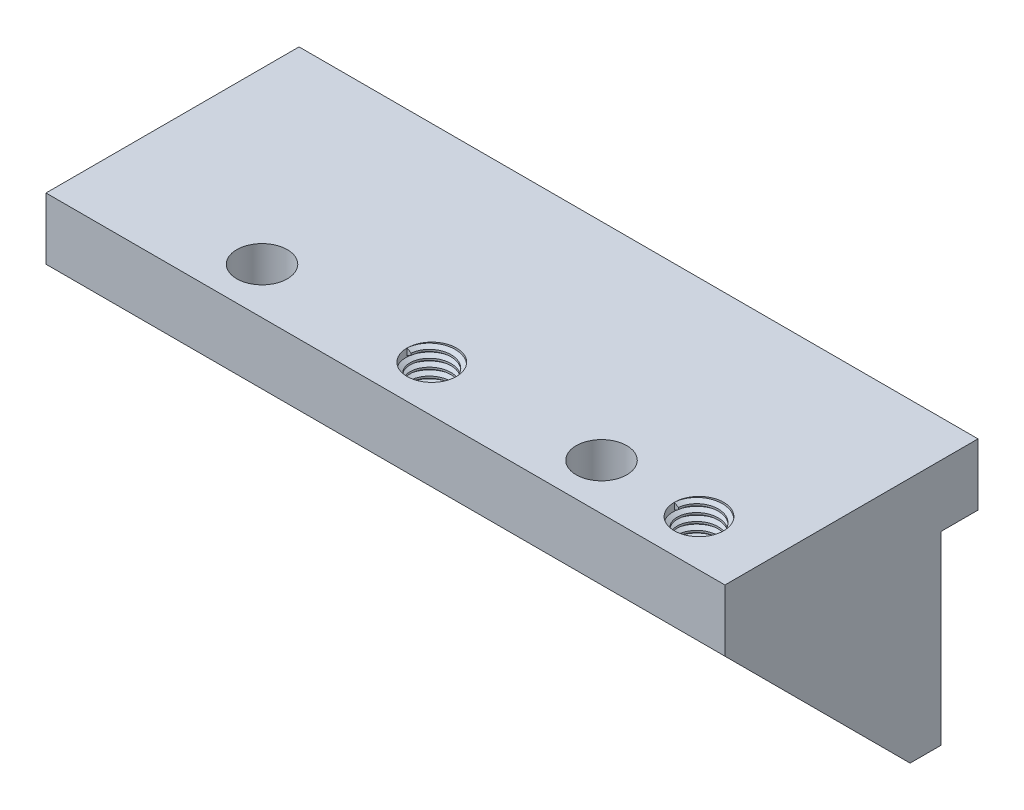
from build123d import *

# Parameters (mm, degrees)
SKETCH1_W           = 110
SKETCH1_H           = 30
SKETCH1_R           = 3.1
BOSS_EXTRUDE1_DEPTH = 5
SKETCH2_W           = 110
SKETCH2_H           = 11
SKETCH2_H_2         = 30
SKETCH2_R           = 4.1
SKETCH2_R_2         = 4
BOSS_EXTRUDE2_DEPTH = 10
BOSS_EXTRUDE3_DEPTH = 110
SKETCH4_W           = 102
SKETCH4_H           = 30
CUT_EXTRUDE1_DEPTH  = 68.453687816
THREAD1_PITCH       = 1.25
THREAD2_PITCH       = 1.25


with BuildPart() as part:
    # Sketch1 → Boss-Extrude1 (new body)
    with BuildSketch(Plane.XY):
        Rectangle(SKETCH1_W, SKETCH1_H)
        with Locations((27.5, 0)):
            Circle(SKETCH1_R, mode=Mode.SUBTRACT)
        with Locations((-27.5, 0)):
            Circle(SKETCH1_R, mode=Mode.SUBTRACT)
    extrude(amount=BOSS_EXTRUDE1_DEPTH)

    # Sketch2 → Boss-Extrude2 (add)
    # profile 1 of 2: a face of its own
    with BuildSketch(Plane(origin=(0, 15, 0), x_dir=(1, 0, 0), z_dir=(0, 1, 0))):
        with Locations((0, 0.5)):
            Rectangle(SKETCH2_W, SKETCH2_H)
    # profile 2 of 2: a face of its own
    with BuildSketch(Plane(origin=(0, 15, 0), x_dir=(1, 0, 0), z_dir=(0, 1, 0))):
        with Locations((0, -20)):
            Rectangle(SKETCH2_W, SKETCH2_H_2)
        with Locations(Location((-27.5, -27.5, 0), (0, 0, 270))):
            Circle(SKETCH2_R, mode=Mode.SUBTRACT)
        with Locations(Location((0, -27.5, 0), (0, 0, 270))):
            Circle(SKETCH2_R_2, mode=Mode.SUBTRACT)
        with Locations(Location((27.5, -27.5, 0), (0, 0, 270))):
            Circle(SKETCH2_R, mode=Mode.SUBTRACT)
        with Locations(Location((43.3, -27.5, 0), (0, 0, 270))):
            Circle(SKETCH2_R_2, mode=Mode.SUBTRACT)
    extrude(amount=BOSS_EXTRUDE2_DEPTH)

    # Sketch3 → Boss-Extrude3 (add, through all)
    with BuildSketch(Plane(origin=(55, 0, 0), x_dir=(0, 0, -1), z_dir=(1, 0, 0))):
        Polygon((-35, 15), (-5, -15), (-5, 15), align=None)
    extrude(amount=-BOSS_EXTRUDE3_DEPTH)

    # Sketch4 → Cut-Extrude1 (cut, through all)
    with BuildSketch(Plane.XY.offset(5)):
        Rectangle(SKETCH4_W, SKETCH4_H)
    extrude(amount=CUT_EXTRUDE1_DEPTH, mode=Mode.SUBTRACT)

    # Thread1: the profile of Thread Profile1 profile screwed along a right-hand helix of 7.12 turns, 8 arcs to a turn; built about Z, then put on its axis
    thread1_z = Axis((0, 0, 0), (0, 0, 1))
    thread1_corners = [(4.0003, 0, -0.000173205), (4.0003, 0, 1.093923202), (3.323417656, 0, 0.703124998), (3.323417656, 0, 0.390624998)]
    with BuildLine(mode=Mode.PRIVATE) as thread1_profile:
        Line(thread1_corners[0], thread1_corners[1])
        Line(thread1_corners[1], thread1_corners[2])
        Line(thread1_corners[2], thread1_corners[3])
        Line(thread1_corners[3], thread1_corners[0])
    thread1_cap = Face(thread1_profile.wire())
    thread1_turn_angles = [0, 22.5, 45, 67.5, 90, 112.5, 135, 157.5, 180, 202.5, 225, 247.5, 270, 292.5, 315, 337.5, 360]
    thread1_turn_weights = [1, 0.9238795325112867, 1, 0.9238795325112867, 1, 0.9238795325112867, 1, 0.9238795325112867, 1, 0.9238795325112867, 1, 0.9238795325112867, 1, 0.9238795325112867, 1, 0.9238795325112867, 1]
    thread1_turn_rails = [Edge.make_bspline([Vector(p[0], p[1], 0).rotate(thread1_z, thread1_turn_angles[k]) / thread1_turn_weights[k] + Vector(0, 0, p[2] + THREAD1_PITCH * thread1_turn_angles[k] / 360) for k in range(17)], [0, 0, 0, 1, 1, 2, 2, 3, 3, 4, 4, 5, 5, 6, 6, 7, 7, 8, 8, 8], 2, thread1_turn_weights) for p in thread1_corners]
    thread1_turn_sides = [Face.make_surface_from_curves(thread1_turn_rails[p[0]], thread1_turn_rails[p[1]]) for p in [(0, 1), (1, 2), (2, 3), (3, 0)]]
    thread1_last_angles = [2520, 2541.6, 2563.2]
    thread1_last_weights = [1, 0.929776485888252, 1]
    thread1_last_rails = [Edge.make_bspline([Vector(p[0], p[1], 0).rotate(thread1_z, thread1_last_angles[k]) / thread1_last_weights[k] + Vector(0, 0, p[2] + THREAD1_PITCH * thread1_last_angles[k] / 360) for k in range(3)], [0, 0, 0, 1, 1, 1], 2, thread1_last_weights) for p in thread1_corners]
    thread1_last_sides = [Face.make_surface_from_curves(thread1_last_rails[p[0]], thread1_last_rails[p[1]]) for p in [(0, 1), (1, 2), (2, 3), (3, 0)]]
    thread1 = Plane(origin=(43.3, 25, 27.5), x_dir=(-1, 0, 0), z_dir=(0, -1, 0)) * Solid(Shell([*[p.moved(Location((0, 0, THREAD1_PITCH * i))) for i in range(7) for p in thread1_turn_sides], *thread1_last_sides, thread1_cap, thread1_cap.rotate(thread1_z, 2563.2).moved(Location((0, 0, THREAD1_PITCH * 2563.2 / 360)))]))
    add(thread1)

    # Thread2: the profile of Thread Profile2 profile screwed along a right-hand helix of 7.12 turns, 8 arcs to a turn; built about Z, then put on its axis
    thread2_z = Axis((0, 0, 0), (0, 0, 1))
    thread2_corners = [(4.0003, 0, -0.000173205), (4.0003, 0, 1.093923202), (3.323417656, 0, 0.703124998), (3.323417656, 0, 0.390624998)]
    with BuildLine(mode=Mode.PRIVATE) as thread2_profile:
        Line(thread2_corners[0], thread2_corners[1])
        Line(thread2_corners[1], thread2_corners[2])
        Line(thread2_corners[2], thread2_corners[3])
        Line(thread2_corners[3], thread2_corners[0])
    thread2_cap = Face(thread2_profile.wire())
    thread2_turn_angles = [0, 22.5, 45, 67.5, 90, 112.5, 135, 157.5, 180, 202.5, 225, 247.5, 270, 292.5, 315, 337.5, 360]
    thread2_turn_weights = [1, 0.9238795325112867, 1, 0.9238795325112867, 1, 0.9238795325112867, 1, 0.9238795325112867, 1, 0.9238795325112867, 1, 0.9238795325112867, 1, 0.9238795325112867, 1, 0.9238795325112867, 1]
    thread2_turn_rails = [Edge.make_bspline([Vector(p[0], p[1], 0).rotate(thread2_z, thread2_turn_angles[k]) / thread2_turn_weights[k] + Vector(0, 0, p[2] + THREAD2_PITCH * thread2_turn_angles[k] / 360) for k in range(17)], [0, 0, 0, 1, 1, 2, 2, 3, 3, 4, 4, 5, 5, 6, 6, 7, 7, 8, 8, 8], 2, thread2_turn_weights) for p in thread2_corners]
    thread2_turn_sides = [Face.make_surface_from_curves(thread2_turn_rails[p[0]], thread2_turn_rails[p[1]]) for p in [(0, 1), (1, 2), (2, 3), (3, 0)]]
    thread2_last_angles = [2520, 2541.6, 2563.2]
    thread2_last_weights = [1, 0.929776485888252, 1]
    thread2_last_rails = [Edge.make_bspline([Vector(p[0], p[1], 0).rotate(thread2_z, thread2_last_angles[k]) / thread2_last_weights[k] + Vector(0, 0, p[2] + THREAD2_PITCH * thread2_last_angles[k] / 360) for k in range(3)], [0, 0, 0, 1, 1, 1], 2, thread2_last_weights) for p in thread2_corners]
    thread2_last_sides = [Face.make_surface_from_curves(thread2_last_rails[p[0]], thread2_last_rails[p[1]]) for p in [(0, 1), (1, 2), (2, 3), (3, 0)]]
    thread2 = Plane(origin=(0, 25, 27.5), x_dir=(-1, 0, 0), z_dir=(0, -1, 0)) * Solid(Shell([*[p.moved(Location((0, 0, THREAD2_PITCH * i))) for i in range(7) for p in thread2_turn_sides], *thread2_last_sides, thread2_cap, thread2_cap.rotate(thread2_z, 2563.2).moved(Location((0, 0, THREAD2_PITCH * 2563.2 / 360)))]))
    add(thread2)


solid = part.part
